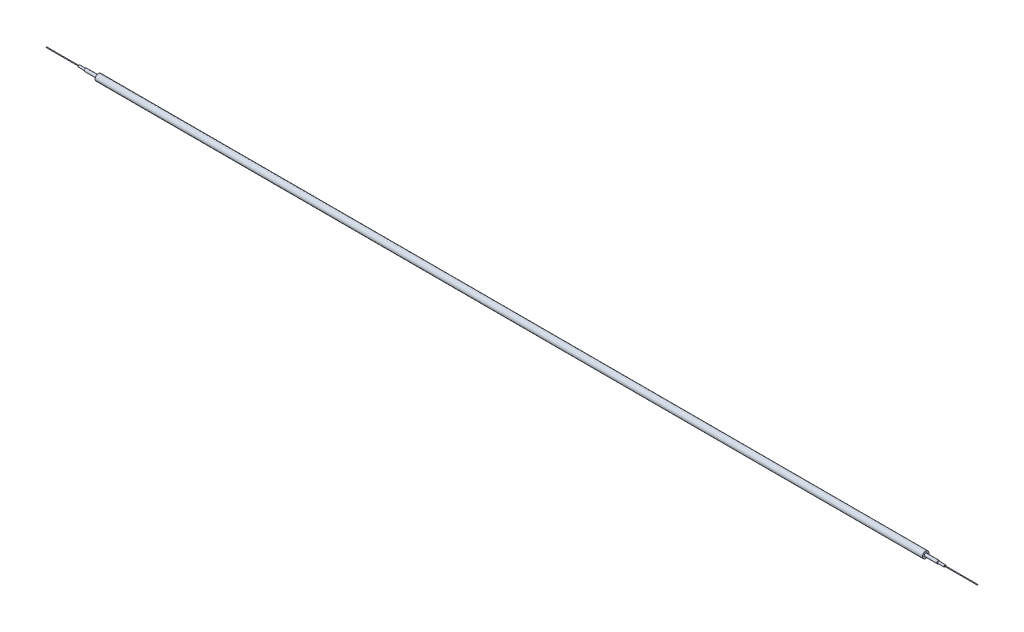
from build123d import *

# Parameters (mm, degrees)
SKETCH3_R           = 12.7
BOSS_EXTRUDE1_DEPTH = 3230.88
SKETCH4_R           = 5.4991
BOSS_EXTRUDE2_DEPTH = 50.8
BOSS_EXTRUDE3_START = 50.8
SKETCH5_R           = 5.4991
BOSS_EXTRUDE3_DEPTH = 50.8
SKETCH6_R           = 3.81
BOSS_EXTRUDE4_DEPTH = 25.4
BOSS_EXTRUDE5_START = 25.4
SKETCH7_R           = 3.81
BOSS_EXTRUDE5_DEPTH = 25.4
CHAMFER1_SIZE       = 1.27
SKETCH8_R           = 1.27
BOSS_EXTRUDE6_DEPTH = 127
BOSS_EXTRUDE7_START = 127
SKETCH9_R           = 1.27
BOSS_EXTRUDE7_DEPTH = 127


with BuildPart() as part:
    # Sketch3 → Boss-Extrude1 (new body)
    with BuildSketch(Plane(origin=(0, 0, 0), x_dir=(0, 0, -1), z_dir=(1, 0, 0))):
        Circle(SKETCH3_R)
    extrude(amount=BOSS_EXTRUDE1_DEPTH)

    # Sketch4 → Boss-Extrude2 (add)
    with BuildSketch(Plane(origin=(3230.88, 0, 0), x_dir=(0, 0, -1), z_dir=(1, 0, 0))):
        Circle(SKETCH4_R)
    extrude(amount=BOSS_EXTRUDE2_DEPTH)

    # Sketch5 → Boss-Extrude3 (add)
    with BuildSketch(Plane.ZY.offset(BOSS_EXTRUDE3_START)):
        Circle(SKETCH5_R)
    extrude(amount=-BOSS_EXTRUDE3_DEPTH)

    # Sketch6 → Boss-Extrude4 (add)
    with BuildSketch(Plane.ZY.offset(50.8)):
        Circle(SKETCH6_R)
    extrude(amount=BOSS_EXTRUDE4_DEPTH)

    # Sketch7 → Boss-Extrude5 (add)
    with BuildSketch(Plane(origin=(3281.68, 0, 0), x_dir=(0, 0, -1), z_dir=(1, 0, 0)).offset(BOSS_EXTRUDE5_START)):
        Circle(SKETCH7_R)
    extrude(amount=-BOSS_EXTRUDE5_DEPTH)

    # Chamfer1
    chamfer1_edges = [part.edges().sort_by_distance(p)[0] for p in [
        (-76.2, 0, -3.81),
        (-50.8, 0, -5.4991),
        (3307.08, 0, 3.81),
        (3281.68, 0, 5.4991),
    ]]
    chamfer(chamfer1_edges, length=CHAMFER1_SIZE)

    # Sketch8 → Boss-Extrude6 (add)
    with BuildSketch(Plane.ZY.offset(76.2)):
        Circle(SKETCH8_R)
    extrude(amount=BOSS_EXTRUDE6_DEPTH)

    # Sketch9 → Boss-Extrude7 (add)
    with BuildSketch(Plane(origin=(3307.08, 0, 0), x_dir=(0, 0, -1), z_dir=(1, 0, 0)).offset(BOSS_EXTRUDE7_START)):
        Circle(SKETCH9_R)
    extrude(amount=-BOSS_EXTRUDE7_DEPTH)


solid = part.part
